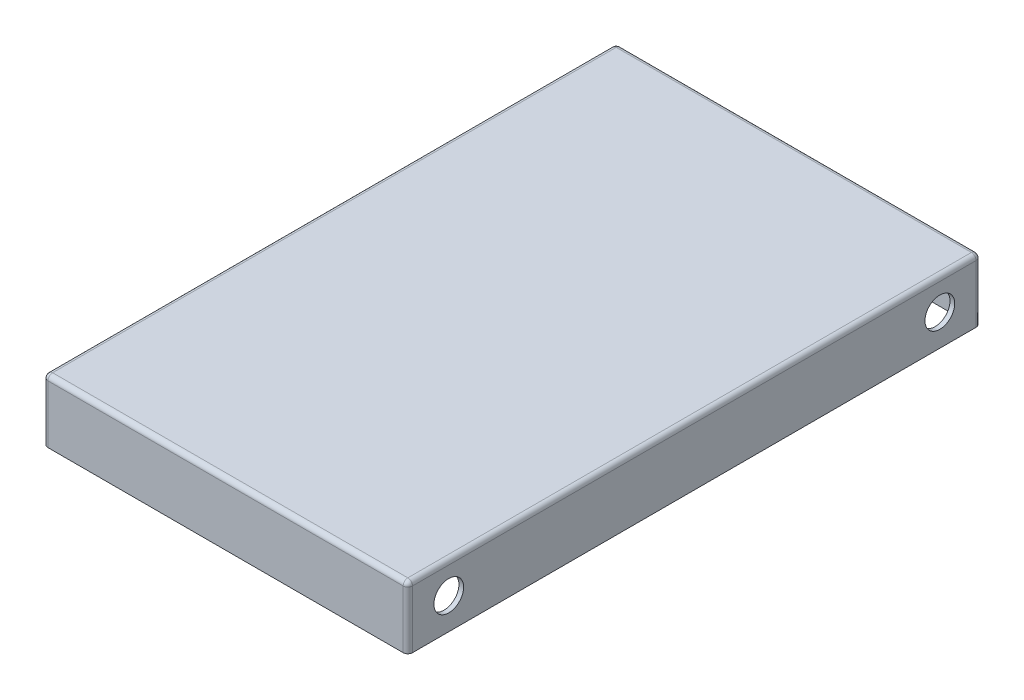
from build123d import *

# Parameters (mm, degrees)
SKETCH1_W           = 311.15
SKETCH1_H           = 488.95
BOSS_EXTRUDE1_DEPTH = 53.34
FILLET1_R           = 4
SHELL1_START        = -151.575
SHELL1_OUTLINE_W    = 49.34
SHELL1_OUTLINE_H    = 480.95
SHELL1_DEPTH        = 303.15
SKETCH2_R           = 12.67938946
CUT_EXTRUDE1_DEPTH  = 400.283738368


# Read off the part's stored shape, not the designer's step: Shell1
with BuildPart() as part:
    # Sketch1 → Boss-Extrude1 (new body)
    with BuildSketch(Plane(origin=(0, 0, 0), x_dir=(1, 0, 0), z_dir=(0, 1, 0))):
        Rectangle(SKETCH1_W, SKETCH1_H)
    extrude(amount=BOSS_EXTRUDE1_DEPTH)

    # Fillet1
    fillet1_edges = [part.edges().sort_by_distance(p)[0] for p in [
        (155.575, 53.34, 0),
        (0, 53.34, -244.475),
        (-155.575, 53.34, 0),
        (-155.575, 26.67, -244.475),
        (155.575, 26.67, -244.475),
        (155.575, 26.67, 244.475),
        (-155.575, 26.67, 244.475),
        (0, 53.34, 244.475),
    ]]
    fillet(fillet1_edges, radius=FILLET1_R)

    # Shell1 outline → Shell1 (cut)
    with BuildSketch(Plane.YZ.offset(SHELL1_START)):
        with Locations((24.67, 0)):
            Rectangle(SHELL1_OUTLINE_W, SHELL1_OUTLINE_H)
    extrude(amount=SHELL1_DEPTH, mode=Mode.SUBTRACT)

    # Sketch2 → Cut-Extrude1 (cut, through all)
    with BuildSketch(Plane(origin=(155.575, 0, 0), x_dir=(0, 0, -1), z_dir=(1, 0, 0))):
        with Locations((-209.55, 26.67)):
            Circle(SKETCH2_R)
        with Locations((209.55, 26.67)):
            Circle(SKETCH2_R)
    extrude(amount=-CUT_EXTRUDE1_DEPTH, mode=Mode.SUBTRACT)


solid = part.part
